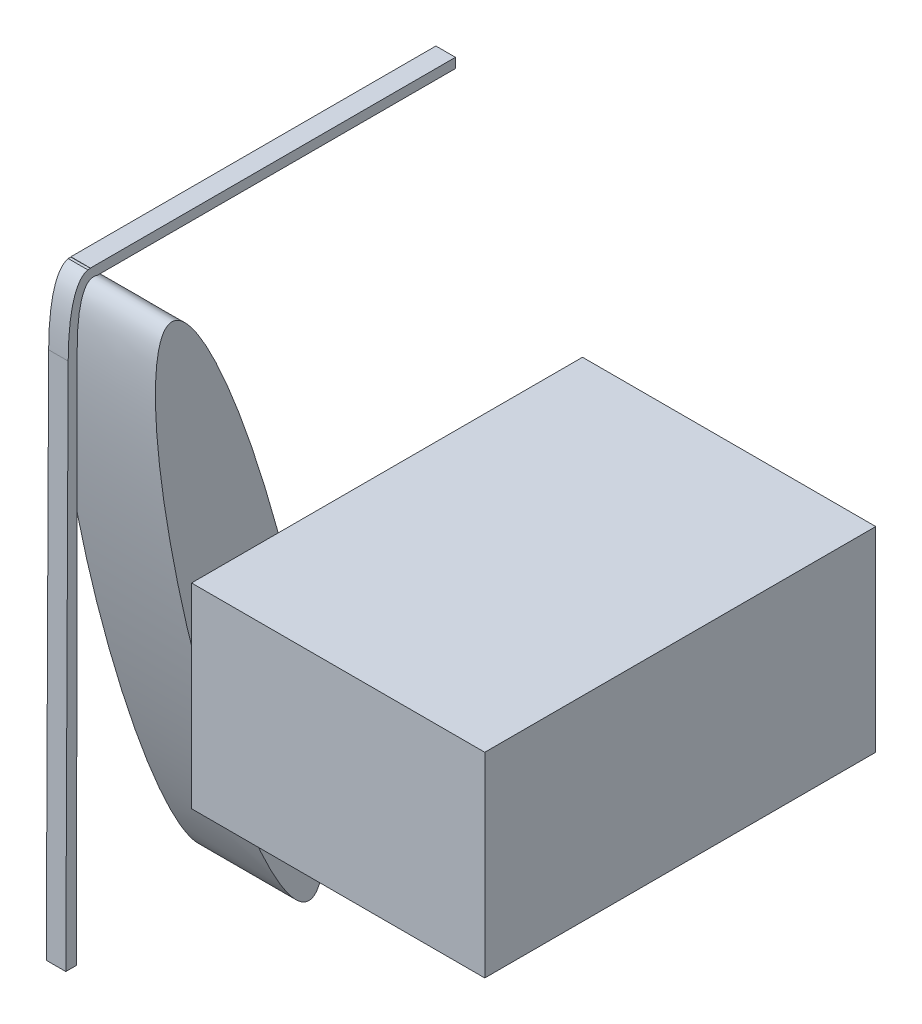
from build123d import *

# Parameters (mm, degrees)
SKETCH_1_W      = 30
SKETCH_1_H      = 20
EXTRUDE_1_DEPTH = 40
SKETCH_2_R      = 2
EXTRUDE_2_DEPTH = 5
SKETCH_3_RX     = 30
SKETCH_3_RY     = 5
EXTRUDE_3_DEPTH = 10
SKETCH_4_W      = 37.348500324
SKETCH_4_H      = 1
EXTRUDE_4_DEPTH = 2
EXTRUDE_START   = -2
EXTRUDE_5_DEPTH = 2


# Read off the part's stored shape, not the designer's step: 凸台-拉伸5
with BuildPart() as part:
    # 草图1 → 凸台-拉伸1 (new body)
    with BuildSketch(Plane.XY):
        with Locations((15, 10)):
            Rectangle(SKETCH_1_W, SKETCH_1_H)
    extrude(amount=EXTRUDE_1_DEPTH)

    # 草图2 → 凸台-拉伸2 (add)
    with BuildSketch(Plane.ZY):
        with Locations(Location((30, 10, 0), (0, 0, 180))):
            Circle(SKETCH_2_R)
    extrude(amount=EXTRUDE_2_DEPTH)

    # 草图3 → 凸台-拉伸3 (add)
    with BuildSketch(Plane.ZY.offset(5)):
        with Locations(Location((30, 10), (0, 0, -103.92099691))):
            Ellipse(SKETCH_3_RX, SKETCH_3_RY)
    extrude(amount=EXTRUDE_3_DEPTH)

    # 草图4 → 凸台-拉伸4 (add)
    with BuildSketch(Plane.ZY.offset(15)):
        with Locations((18.674250162, 39.574648358)):
            Rectangle(SKETCH_4_W, SKETCH_4_H)
    extrude(amount=-EXTRUDE_4_DEPTH)

    # 凸台-拉伸5 outline → 凸台-拉伸5 (add)
    with BuildSketch(Plane.ZY.offset(15).offset(EXTRUDE_START)):
        with BuildLine():
            Line((39.862468471, -21), (39.619125683, 32.967296936))
            add(Edge.make_bspline(
                [(39.619125683, 32.967296936), (39.589392589, 39.561347803), (37.614649654, 40.050686248)],
                knots=[5.629361553, 5.629361553, 5.629361553, 6.283185307, 6.283185307, 6.283185307], degree=2, weights=[1, 0.947038516, 1]))
            Line((37.614649654, 40.050686248), (37.348500324, 40.050855796))
            Line((37.348500324, 40.050855796), (37.348500324, 39.074648358))
            add(Edge.make_bspline(
                [(38.697434301, 33.514015855), (38.694345199, 38.494694197), (37.348500324, 39.074648358)],
                knots=[5.657287765, 5.657287765, 5.657287765, 6.250122592, 6.250122592, 6.250122592], degree=2, weights=[0.790463711, 0.847402464, 0.984462923]))
            Line((38.697434301, 33.514015855), (38.765118588, -21))
            Line((38.765118588, -21), (39.862468471, -21))
        make_face()
    extrude(amount=EXTRUDE_5_DEPTH)


solid = part.part
